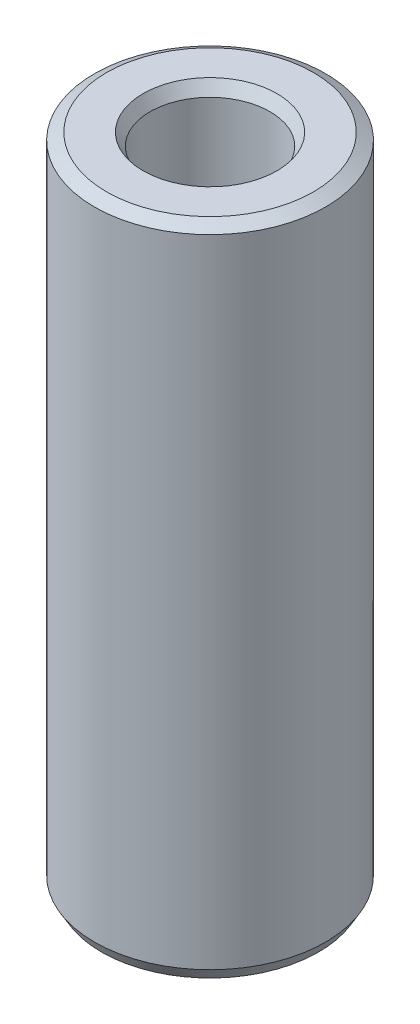
from build123d import *
from OCP.BRepFilletAPI import BRepFilletAPI_MakeChamfer

# Parameters (mm, degrees)
SKETCH1_R           = 20
BOSS_EXTRUDE1_DEPTH = 113.487181822
SKETCH2_R           = 10.370016663
CUT_EXTRUDE1_DEPTH  = 117.958712535
CHAMFER1_SIZE       = 1.213757402
CHAMFER1_SIZE2      = 2.102289488


with BuildPart() as part:
    # Sketch1 → Boss-Extrude1 (new body)
    with BuildSketch(Plane(origin=(0, 0, 0), x_dir=(1, 0, 0), z_dir=(0, 1, 0))):
        Circle(SKETCH1_R)
    extrude(amount=BOSS_EXTRUDE1_DEPTH)

    # Sketch2 → Cut-Extrude1 (cut, through all)
    with BuildSketch(Plane(origin=(0, 0, 0), x_dir=(1, 0, 0), z_dir=(0, 1, 0))):
        Circle(SKETCH2_R)
    extrude(amount=CUT_EXTRUDE1_DEPTH, mode=Mode.SUBTRACT)

    # Chamfer1: one chamfer whose edges measure the first distance from different faces: ONE call of the kernel's chamfer builder (chamfer() names one face for all edges)
    chamfer1_edges_1 = [part.edges().sort_by_distance(p)[0] for p in [
        (-10.370016663, 113.487181822, 0),
    ]]
    chamfer1_side_1 = [part.faces().sort_by_distance(p)[0] for p in [
        (-19.434314575, 113.487181822, 0),
    ]]
    chamfer1_edges_2 = [part.edges().sort_by_distance(p)[0] for p in [
        (-10.370016663, 0, 0),
    ]]
    chamfer1_side_2 = [part.faces().sort_by_distance(p)[0] for p in [
        (-10.370016663, 56.743590911, 0),
    ]]
    chamfer1_edges_3 = [part.edges().sort_by_distance(p)[0] for p in [
        (-20, 0, 0),
    ]]
    chamfer1_side_3 = [part.faces().sort_by_distance(p)[0] for p in [
        (-19.434314575, 0, 0),
    ]]
    chamfer1_edges_4 = [part.edges().sort_by_distance(p)[0] for p in [
        (-20, 113.487181822, 0),
    ]]
    chamfer1_side_4 = [part.faces().sort_by_distance(p)[0] for p in [
        (-20, 56.743590911, 0),
    ]]
    chamfer1 = BRepFilletAPI_MakeChamfer(part.part.solid().wrapped)
    for e in chamfer1_edges_1:
        chamfer1.Add(CHAMFER1_SIZE, CHAMFER1_SIZE2, e.wrapped, chamfer1_side_1[0].wrapped)  # the first distance lies on this face
    for e in chamfer1_edges_2:
        chamfer1.Add(CHAMFER1_SIZE, CHAMFER1_SIZE2, e.wrapped, chamfer1_side_2[0].wrapped)  # the first distance lies on this face
    for e in chamfer1_edges_3:
        chamfer1.Add(CHAMFER1_SIZE, CHAMFER1_SIZE2, e.wrapped, chamfer1_side_3[0].wrapped)  # the first distance lies on this face
    for e in chamfer1_edges_4:
        chamfer1.Add(CHAMFER1_SIZE, CHAMFER1_SIZE2, e.wrapped, chamfer1_side_4[0].wrapped)  # the first distance lies on this face
    add(Compound.cast(chamfer1.Shape()), mode=Mode.REPLACE)


solid = part.part
